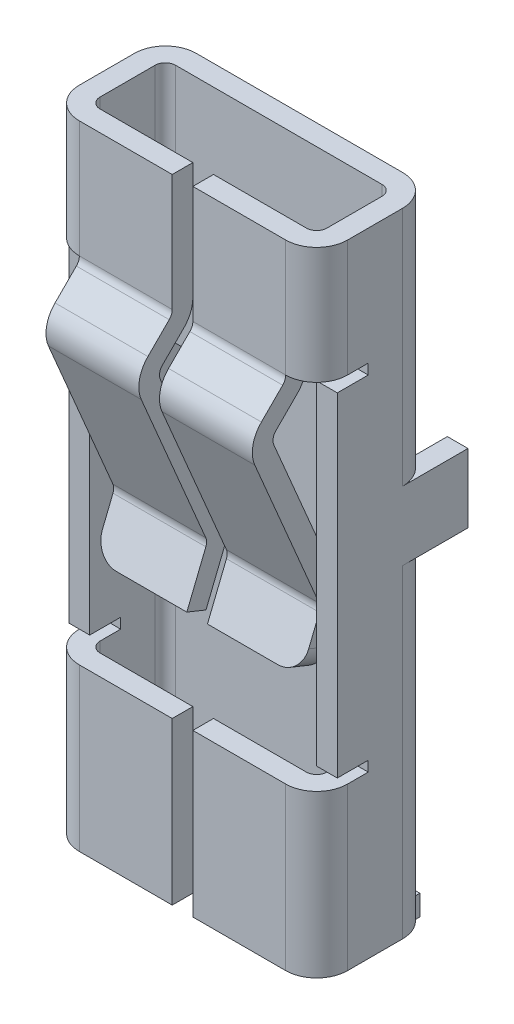
from build123d import *

# Parameters (mm, degrees)
BOSS_EXTRUDE1_DEPTH   = 1.35
BOSS_EXTRUDE1_START   = -0.15
BOSS_EXTRUDE1_2_DEPTH = 0.15
SKETCH2_W             = 0.3000000000000001
SKETCH2_H             = 9.200000000000003
BOSS_EXTRUDE2_DEPTH   = 3.1499999999999995
BOSS_EXTRUDE3_DEPTH   = 0.29999999999999993
BOSS_EXTRUDE4_DEPTH   = 0.30000000000000016
CUT_EXTRUDE1_DEPTH    = 0.15000000000000127
BOSS_EXTRUDE5_DEPTH   = 0.15000000000000127
BOSS_EXTRUDE6_DEPTH   = 1.3500000000000003
CUT_EXTRUDE2_DEPTH    = 0.3000000000000021
CUT_EXTRUDE3_DEPTH    = 0.29999999999999927
CUT_EXTRUDE4_DEPTH    = 0.15000000000000385
CUT_EXTRUDE5_DEPTH    = 0.1500000000000002
BOSS_EXTRUDE7_DEPTH   = 0.32500023179600646
SKETCH13_W            = 2.4
SKETCH13_H            = 0.30000000000000016
BOSS_EXTRUDE8_DEPTH   = 0.7500000000000016
BOSS_EXTRUDE9_DEPTH   = 0.3000000000000004
SKETCH15_W            = 0.30000000000000016
SKETCH15_H            = 0.6000000000000005
BOSS_EXTRUDE10_DEPTH  = 0.3000000000000004
BOSS_EXTRUDE11_DEPTH  = 1
SKETCH17_W            = 0.30000000000000004
SKETCH17_H            = 2.350000000000001
BOSS_EXTRUDE12_DEPTH  = 0.7499999999999998
SKETCH18_W            = 0.30000000000000004
SKETCH18_H            = 2.350000000000001
BOSS_EXTRUDE13_DEPTH  = 1.5000000000000007
BOSS_EXTRUDE14_DEPTH  = 0.4499999999999999
BOSS_EXTRUDE15_DEPTH  = 1.0499999999999998
SKETCH21_W            = 1.5
SKETCH21_H            = 0.2999999999999998
BOSS_EXTRUDE16_DEPTH  = 1
BOSS_EXTRUDE17_DEPTH  = 0.7499999999999999
SKETCH23_W            = 0.30000000000000004
SKETCH23_H            = 2.350000000000001
BOSS_EXTRUDE18_DEPTH  = 1.5000000000000004
SKETCH24_W            = 0.30000000000000004
SKETCH24_H            = 4.8500000000000005
BOSS_EXTRUDE19_DEPTH  = 0.4499999999999999
DRAFT1_START          = -1.5
DRAFT1_DEPTH          = 1.35
DRAFT2_START          = -1.5
DRAFT2_DEPTH          = 1.35
DRAFT3_ANGLE          = 45.00000000000445
DRAFT4_ANGLE          = 44.99999999999104
FILLET1_R             = 0.15000000000000022
FILLET2_R             = 0.3250000000000042
FILLET3_R             = 0.45
FILLET4_DEPTH         = 0.3
FILLET4_START         = 2.200609665
FILLET4_2_DEPTH       = 0.3
CUT_EXTRUDE6_DEPTH    = 10
CUT_EXTRUDE7_DEPTH    = 0.5
BOSS_EXTRUDE20_DEPTH  = 1


with BuildPart() as part:
    # Boss-Extrude1: read off the stored shape, not the designer's step
    # Boss-Extrude1 outline → Boss-Extrude1 (new body)
    with BuildSketch(Plane(origin=(-1.4999999999999991, 0, 0), x_dir=(0, 0, -1), z_dir=(1, 0, 0))):
        Polygon((-3.114213562, 4.812132034), (-1.7, 4.812132034), (-1.7, 2.987867966), (-2.509359079, 2.987867966), (-1.188010503, -0.125034203), (-1.365948548, -0.565446319), (-1.087793392, -0.677828297), (-0.863305207, -0.122200542), (-2.130703998, 2.863603897), (-1.4, 2.863603897), (-1.4, 4.936396103), (-2.989949494, 4.936396103), align=None)
    extrude(amount=BOSS_EXTRUDE1_DEPTH)

    # Boss-Extrude1 2 outline → Boss-Extrude1 2 (add)
    with BuildSketch(Plane(origin=(-1.4999999999999991, 0, 0), x_dir=(0, 0, -1), z_dir=(1, 0, 0)).offset(BOSS_EXTRUDE1_START)):
        Polygon((-3.114213562, 4.812132034), (-1.7, 4.812132034), (-1.7, 3.05), (-0.95, 3.05), (-0.95, -4.45), (0, -4.45), (0, 4.75), (-1.4, 4.75), (-1.4, 4.936396103), (-2.989949494, 4.936396103), align=None)
    extrude(amount=BOSS_EXTRUDE1_2_DEPTH)

    # Sketch2 → Boss-Extrude2 (add)
    with BuildSketch(Plane(origin=(-1.4999999999999991, 0, 0), x_dir=(0, 0, -1), z_dir=(1, 0, 0))):
        with Locations((-0.15000000000000005, 0.1499999999999999)):
            Rectangle(SKETCH2_W, SKETCH2_H)
    extrude(amount=BOSS_EXTRUDE2_DEPTH)

    # Sketch3 → Boss-Extrude3 (add)
    with BuildSketch(Plane(origin=(1.6500000000000004, 0, 0), x_dir=(0, 0, -1), z_dir=(1, 0, 0))):
        Polygon((-0.9500000000000003, -4.450000000000001), (-0.9500000000000003, 3.0500000000000007), (-1.7000000000000002, 3.0500000000000007), (-1.7000000000000002, 4.812132034356001), (-3.1142135623726666, 4.812132034356001), (-2.989949493660945, 4.936396103067781), (-1.4000000000000001, 4.936396103067781), (-1.4000000000000035, 4.750000000000001), (0, 4.750000000000001), (0, -4.450000000000001), align=None)
    extrude(amount=BOSS_EXTRUDE3_DEPTH)

    # Sketch4 → Boss-Extrude4 (add)
    with BuildSketch(Plane.ZY.offset(1.6500000000000001)):
        Polygon((0.9500000000000002, -4.450000000000001), (0, -4.450000000000001), (0, 4.749999999999999), (1.4000000000000037, 4.750000000000001), (1.4000000000000001, 4.936396103067801), (2.9899494936609243, 4.936396103067802), (3.1142135623726666, 4.812132034356001), (1.7000000000000002, 4.812132034356001), (1.7000000000000002, 3.0500000000000007), (0.9500000000000003, 3.0500000000000007), align=None)
    extrude(amount=BOSS_EXTRUDE4_DEPTH)

    # Sketch5 → Cut-Extrude1 (cut)
    with BuildSketch(Plane(origin=(-1.4999999999999991, 0, 0), x_dir=(0, 0, -1), z_dir=(1, 0, 0))):
        Polygon((-0.9500000000000003, 3.0500000000000007), (-0.9500000000000002, -4.450000000000001), (-0.30000000000000004, -4.450000000000001), (-0.30000000000000016, 4.750000000000001), (-1.4000000000000037, 4.750000000000001), (-1.4000000000000001, 3.0500000000000007), align=None)
    extrude(amount=-CUT_EXTRUDE1_DEPTH, mode=Mode.SUBTRACT)

    # Sketch6 → Boss-Extrude5 (add)
    with BuildSketch(Plane.ZY.offset(-1.6500000000000004)):
        Polygon((1.7000000000000002, 4.812132034356001), (1.7000000000000002, 3.0500000000000007), (1.4000000000000197, 3.0500000000000007), (1.4000000000000001, 4.936396103067882), (2.9899494936608453, 4.936396103067881), (3.1142135623726666, 4.812132034356001), align=None)
    extrude(amount=BOSS_EXTRUDE5_DEPTH)

    # Sketch7 → Boss-Extrude6 (add)
    with BuildSketch(Plane.ZY.offset(-1.4999999999999991)):
        with BuildLine():
            Line((1.7, 2.9878679656439875), (2.5093590788271998, 2.9878679656439675))
            Line((2.5093590788271998, 2.9878679656439675), (2.1495825231129353, 2.1402875156965857))
            add(Edge.make_bspline(
                [(1.2122874229840004, -0.06784136341720032), (1.52471912302698, 0.6682015962873946), (1.8371508230699576, 1.4042445559919898), (2.1495825231129353, 2.1402875156965857)],
                knots=[0, 0, 0, 0, 1, 1, 1, 1], degree=3))
            Line((1.2122874229840004, -0.06784136341720032), (1.188010503084729, -0.12503420259681308))
            Line((1.188010503084729, -0.12503420259681308), (1.2112855728167975, -0.18264202170300106))
            add(Edge.make_bspline(
                [(1.4876957778174003, -0.8667812862502003), (1.3955590428172002, -0.638734864734467), (1.3034223078170002, -0.4106884432187335), (1.2112855728167975, -0.18264202170300106)],
                knots=[0, 0, 0, 0, 1, 1, 1, 1], degree=3))
            add(Edge.make_bspline(
                [(1.2095406214473998, -0.9791632642749003), (1.3022590069040665, -0.9417026049333337), (1.3949773923607334, -0.9042419455917671), (1.4876957778174003, -0.8667812862502003)],
                knots=[0, 0, 0, 0, 1, 1, 1, 1], degree=3))
            add(Edge.make_bspline(
                [(0.9331304164468003, -0.2950239997277002), (1.0252671514470002, -0.5230704212434336), (1.1174038864472, -0.7511168427591669), (1.2095406214473998, -0.9791632642749003)],
                knots=[0, 0, 0, 0, 1, 1, 1, 1], degree=3))
            Line((0.9331304164468003, -0.2950239997277002), (0.8633052072505193, -0.12220054240891351))
            Line((0.8633052072505193, -0.12220054240891351), (0.9361359669482366, 0.04937797512958447))
            add(Edge.make_bspline(
                [(1.8734310670777075, 2.2575068542431853), (1.5609993670345503, 1.5214638945386514), (1.2485676669913934, 0.7854209348341182), (0.9361359669482366, 0.04937797512958447)],
                knots=[0, 0, 0, 0, 1, 1, 1, 1], degree=3))
            Line((1.8734310670777075, 2.2575068542431853), (2.1307039978783813, 2.8636038969319726))
            Line((2.1307039978783813, 2.8636038969319726), (1.400000000000637, 2.863603896931973))
            Line((1.400000000000637, 2.863603896931973), (1.400000000000637, 4.936396103067612))
            Line((1.400000000000637, 4.936396103067612), (2.9899494936614825, 4.936396103067612))
            Line((2.9899494936614825, 4.936396103067612), (3.1142135623733327, 4.812132034355761))
            Line((3.1142135623733327, 4.812132034355761), (1.6999999999999997, 4.812132034355761))
            Line((1.6999999999999997, 4.812132034355761), (1.7, 2.9878679656439875))
        make_face()
    extrude(amount=BOSS_EXTRUDE6_DEPTH)

    # Sketch8 → Cut-Extrude2 (cut)
    with BuildSketch(Plane(origin=(1.9500000000000004, 0, 0), x_dir=(0, 0, -1), z_dir=(1, 0, 0))):
        Polygon((-1.7000000000000002, 4.750000000000001), (-1.4000000000000035, 4.750000000000001), (-1.4000000000000001, 4.936396103067781), (-2.989949493660945, 4.936396103067781), (-3.1142135623726666, 4.812132034356001), (-1.7000000000000002, 4.812132034356001), align=None)
    extrude(amount=-CUT_EXTRUDE2_DEPTH, mode=Mode.SUBTRACT)

    # Sketch9 → Cut-Extrude3 (cut)
    with BuildSketch(Plane.ZY.offset(1.9500000000000004)):
        Polygon((1.7000000000000035, 4.750000000000001), (1.7000000000000002, 4.812132034356001), (3.1142135623726666, 4.812132034356001), (2.9899494936609243, 4.936396103067802), (1.4000000000000001, 4.936396103067801), (1.4000000000000037, 4.750000000000001), align=None)
    extrude(amount=-CUT_EXTRUDE3_DEPTH, mode=Mode.SUBTRACT)

    # Sketch10 → Cut-Extrude4 (cut)
    with BuildSketch(Plane(origin=(1.6499999999999984, 0, 0), x_dir=(-7.23e-15, 0, -1), z_dir=(1, 0, -7.23e-15))):
        Polygon((-1.7000000000000153, 4.750000000000001), (-1.4000000000000155, 4.750000000000001), (-1.4000000000000121, 4.936396103067781), (-2.989949493660957, 4.936396103067781), (-3.1142135623726785, 4.812132034356001), (-1.700000000000012, 4.812132034356001), align=None)
    extrude(amount=-CUT_EXTRUDE4_DEPTH, mode=Mode.SUBTRACT)

    # Sketch11 → Cut-Extrude5 (cut)
    with BuildSketch(Plane.ZY.offset(1.650000000000001)):
        Polygon((1.700000000000013, 4.750000000000018), (1.7000000000000097, 4.8121320343560186), (3.114213562372676, 4.8121320343560186), (2.9899494936609337, 4.936396103067819), (1.4000000000000097, 4.9363961030678185), (1.4000000000000132, 4.750000000000018), align=None)
    extrude(amount=-CUT_EXTRUDE5_DEPTH, mode=Mode.SUBTRACT)

    # Sketch12 → Boss-Extrude7 (add)
    with BuildSketch(Plane(origin=(0, -0.9605309765461568, 0.3880797052513418), x_dir=(1, 0, 0), z_dir=(0, -0.9271838545669052, 0.37460659341562025))):
        Polygon((-0.15000000000000005, 1.0546655208211408), (-0.15000000000000005, 0.7546655208212015), (-1.5, 0.7546655208212013), (-1.5000000000000002, 1.0546655208211408), align=None)
    extrude(amount=BOSS_EXTRUDE7_DEPTH)

    # Sketch13 → Boss-Extrude8 (add)
    with BuildSketch(Plane(origin=(0, 4.750000000000001, 0), x_dir=(-1, 0, 0), z_dir=(0, 1, 0))):
        with Locations((0, 0.15000000000000008)):
            Rectangle(SKETCH13_W, SKETCH13_H)
    extrude(amount=BOSS_EXTRUDE8_DEPTH)

    # Sketch14 → Boss-Extrude9 (add)
    with BuildSketch(Plane.ZY.offset(1.2)):
        Polygon((0, 5.500000000000001), (0.30000000000000016, 5.500000000000001), (0.30000000000000016, 4.900000000000001), (0, 4.9), align=None)
    extrude(amount=BOSS_EXTRUDE9_DEPTH)

    # Sketch15 → Boss-Extrude10 (add)
    with BuildSketch(Plane(origin=(1.2, 0, 0), x_dir=(0, 0, -1), z_dir=(1, 0, 0))):
        with Locations((-0.15000000000000008, 5.200000000000001)):
            Rectangle(SKETCH15_W, SKETCH15_H)
    extrude(amount=BOSS_EXTRUDE10_DEPTH)

    # Sketch16 → Boss-Extrude11 (add)
    with BuildSketch(Plane(origin=(0, 0, 0), x_dir=(-1, 0, 0), z_dir=(0, 0, -1))):
        Polygon((1.4999999999999998, 5.200000000000001), (-1.4999999999999996, 5.200000000000001), (-1.5000000000000002, 5.500000000000001), (1.5000000000000002, 5.500000000000001), align=None)
    extrude(amount=BOSS_EXTRUDE11_DEPTH)

    # Sketch17 → Boss-Extrude12 (add)
    with BuildSketch(Plane.XY.offset(0.9500000000000003)):
        with Locations((1.8000000000000003, -3.2750000000000004)):
            Rectangle(SKETCH17_W, SKETCH17_H)
    extrude(amount=BOSS_EXTRUDE12_DEPTH)

    # Sketch18 → Boss-Extrude13 (add)
    with BuildSketch(Plane.ZY.offset(-1.6500000000000004)):
        with Locations((1.5500000000000003, -3.2750000000000004)):
            Rectangle(SKETCH18_W, SKETCH18_H)
    extrude(amount=BOSS_EXTRUDE13_DEPTH)

    # Sketch19 → Boss-Extrude14 (add)
    with BuildSketch(Plane.XY.offset(0.9500000000000003)):
        Polygon((1.6500000000000004, -1.9500000000000004), (1.6500000000000004, 2.9), (1.9500000000000004, 2.9000000000000004), (1.9500000000000004, -1.9500000000000002), align=None)
    extrude(amount=BOSS_EXTRUDE14_DEPTH)

    # Sketch20 → Boss-Extrude15 (add)
    with BuildSketch(Plane.XZ.offset(4.450000000000001)):
        Polygon((-0.7500000000000001, 0), (-0.7500000000000001, 0.30000000000000016), (0.7500000000000001, 0.30000000000000004), (0.7500000000000001, 0), align=None)
    extrude(amount=BOSS_EXTRUDE15_DEPTH)

    # Sketch21 → Boss-Extrude16 (add)
    with BuildSketch(Plane(origin=(0, 0, 0), x_dir=(-1, 0, 0), z_dir=(0, 0, -1))):
        with Locations((0, -5.350000000000001)):
            Rectangle(SKETCH21_W, SKETCH21_H)
    extrude(amount=BOSS_EXTRUDE16_DEPTH)

    # Sketch22 → Boss-Extrude17 (add)
    with BuildSketch(Plane.XY.offset(0.9500000000000003)):
        Polygon((-1.6500000000000001, -4.450000000000001), (-1.9500000000000004, -4.450000000000001), (-1.9500000000000004, -2.1), (-1.6500000000000004, -2.1), align=None)
    extrude(amount=BOSS_EXTRUDE17_DEPTH)

    # Sketch23 → Boss-Extrude18 (add)
    with BuildSketch(Plane(origin=(-1.6500000000000004, 0, 0), x_dir=(0, 0, -1), z_dir=(1, 0, 0))):
        with Locations((-1.5500000000000003, -3.2750000000000004)):
            Rectangle(SKETCH23_W, SKETCH23_H)
    extrude(amount=BOSS_EXTRUDE18_DEPTH)

    # Sketch24 → Boss-Extrude19 (add)
    with BuildSketch(Plane.XY.offset(0.9500000000000003)):
        with Locations((-1.8000000000000003, 0.475)):
            Rectangle(SKETCH24_W, SKETCH24_H)
    extrude(amount=BOSS_EXTRUDE19_DEPTH)

    # Draft1: read off the stored shape, not the designer's step
    # Draft1 outline → Draft1 (add)
    with BuildSketch(Plane.YZ.offset(DRAFT1_START)):
        Polygon((4.936396103, 2.989949494), (4.936396103, 1.4), (5.73137085, 2.194974747), align=None)
        Polygon((2.863603897, 2.130703998), (2.350640109, 1.912963788), (2.863603897, 1.4), align=None)
    extrude(amount=DRAFT1_DEPTH)

    # Draft2: read off the stored shape, not the designer's step
    # Draft2 outline → Draft2 (cut)
    with BuildSketch(Plane.YZ.offset(DRAFT2_START)):
        Polygon((4.812132034, 1.7), (5.519238816, 2.407106781), (4.812132034, 3.114213562), align=None)
        Polygon((2.419687279, 2.268180686), (2.987867966, 1.7), (2.987867966, 2.509359079), align=None)
    extrude(amount=DRAFT2_DEPTH, mode=Mode.SUBTRACT)

    # Draft3
    draft3_faces = [part.faces().sort_by_distance(p)[0] for p in [
        (0.824999999999999, 2.863603896931973, 1.7653519989395092),
        (0.8250000000000098, 4.936396103067781, 2.194974746830841),
    ]]
    draft(draft3_faces, Plane(origin=(1.9500000000000004, 4.936396103067781, 1.4000000000000001), x_dir=(0, -1, 1.745e-14), z_dir=(0, -1.745e-14, -1)), DRAFT3_ANGLE)

    # Draft4
    draft4_faces = [part.faces().sort_by_distance(p)[0] for p in [
        (0.8249999999999654, 4.812132034356001, 2.4071067811865423),
        (0.824999999999999, 2.9878679656439773, 2.1046795394136),
    ]]
    draft(draft4_faces, Plane(origin=(1.9500000000000004, 3.0500000000000007, 1.7000000000000002), x_dir=(1, 0, 0), z_dir=(0, 0, 1)), DRAFT4_ANGLE)

    # Fillet1
    fillet1_edges = [part.edges().sort_by_distance(p)[0] for p in [
        (-0.82500000000003, 4.812132034, 1.7),
        (-0.825, 2.350640109, 1.912963788),
        (-0.8249999999999991, 2.987867966, 1.7),
        (-0.8249999999999991, -0.125034203, 1.188010503),
        (1.6500000000000004, 0.15000000000000036, 0.3000000000000001),
        (-1.6500000000000004, 3.900000000000001, 1.400000000000002),
        (-1.6500000000000004, 0.15000000000000036, 0.3000000000000001),
        (1.6500000000000004, 3.900000000000001, 1.4000000000000108),
        (0.824999999999999, 2.9878679656439875, 1.7000000000000002),
        (0.824999999999999, 2.350640108760132, 1.9129637881718162),
        (0.824999999999999, -0.12503420259681308, 1.188010503084729),
        (0.8250000000000027, 4.812132034356001, 1.7000000000000002),
        (-2.2e-16, 5.200000000000001, 0),
        (1.6500000000000004, -3.2750000000000004, 1.4000000000000001),
        (1.1e-16, -5.200000000000001, 0),
        (-1.6500000000000004, -3.2750000000000004, 1.4000000000000001),
    ]]
    fillet(fillet1_edges, radius=FILLET1_R)

    # Fillet2
    fillet2_edges = [part.edges().sort_by_distance(p)[0] for p in [
        (-1.5, -0.922972275262529, 1.3486181996324813),
        (1.4999999999999991, -0.9229722752625503, 1.3486181996324),
    ]]
    fillet(fillet2_edges, radius=FILLET2_R)

    # Fillet3
    fillet3_edges = [part.edges().sort_by_distance(p)[0] for p in [
        (-0.8249999999999991, -0.122200542, 0.863305207),
        (-0.8249999999999991, 2.863603897, 1.4),
        (-0.825, 2.419687279, 2.268180686),
        (1.9500000000000002, 0.14999999999999947, 0),
        (-1.9500000000000002, 3.900000000000001, 1.7000000000000002),
        (-1.9500000000000002, 0.14999999999999858, 0),
        (0.824999999999999, 2.863603896931973, 1.4000000000000372),
        (0.824999999999999, -0.12220054240891351, 0.8633052072505193),
        (0.824999999999999, 2.4196872792485182, 2.268180686395647),
        (1.9500000000000002, 3.900000000000001, 1.7000000000000002),
        (0.8250000000000017, 4.936396103067781, 1.4000000000000001),
        (-0.8250000000000298, 4.936396103, 1.4),
        (0, 5.500000000000001, 0.30000000000000016),
        (1.9500000000000004, -3.2750000000000004, 1.7000000000000002),
        (0, -5.500000000000001, 0.3000000000000001),
        (-1.9500000000000004, -3.2750000000000004, 1.7000000000000002),
    ]]
    fillet(fillet3_edges, radius=FILLET3_R)

    # Fillet4: read off the stored shape, not the designer's step
    # Fillet4 outline → Fillet4 (add)
    with BuildSketch(Plane.XY):
        with BuildLine():
            Line((-0.75, -4.45), (-1.375, -4.45))
            ThreePointArc((-1.375, -4.45), (-0.933058262, -4.633058262), (-0.75, -5.075))
            Line((-0.75, -5.075), (-0.75, -4.45))
        make_face()
        with BuildLine():
            ThreePointArc((0.75, -5.075), (0.933058262, -4.633058262), (1.375, -4.45))
            Line((1.375, -4.45), (0.75, -4.45))
            Line((0.75, -4.45), (0.75, -5.075))
        make_face()
    extrude(amount=FILLET4_DEPTH)

    # Fillet4 2 outline → Fillet4 2 (cut)
    with BuildSketch(Plane(origin=(0, 0, 0), x_dir=(1, 0, 0), z_dir=(0, 0.707106781186714, -0.707106781186381)).offset(FILLET4_START)):
        with BuildLine():
            ThreePointArc((-0.875, -5.604772721), (-1.316941738, -5.421714459), (-1.5, -4.979772721))
            Line((-1.5, -4.979772721), (-1.5, -5.604772721))
            Line((-1.5, -5.604772721), (-0.875, -5.604772721))
        make_face()
        with BuildLine():
            ThreePointArc((1.5, -4.979772721), (1.316941738, -5.421714459), (0.875, -5.604772721))
            Line((0.875, -5.604772721), (1.5, -5.604772721))
            Line((1.5, -5.604772721), (1.5, -4.979772721))
        make_face()
    extrude(amount=FILLET4_2_DEPTH, mode=Mode.SUBTRACT)

    # Sketch25 → Cut-Extrude6 (cut)
    with BuildSketch(Plane(origin=(0, 4.750000000000001, 0), x_dir=(1, 0, 0), z_dir=(0, 1, 0))):
        Polygon((-2.150597413752126, 1.4408106156054146), (2.3120536760458297, 1.4408106156054146), (2.3120536760458292, -3.1035844529903045), (-2.150597413752126, -3.1035844529903045), align=None)
    extrude(amount=CUT_EXTRUDE6_DEPTH, mode=Mode.SUBTRACT)

    # Sketch26 → Cut-Extrude7 (cut)
    with BuildSketch(Plane(origin=(0, 0, 0), x_dir=(-1, 0, 0), z_dir=(0, 0, -1))):
        Polygon((-1.9500000000000004, 1.2500000000000002), (-0.9500000000000003, 1.2500000000000002), (-0.9500000000000002, 0.2500000000000002), (-1.9500000000000002, 0.2500000000000002), align=None)
        Polygon((1.9500000000000004, 1.2500000000000002), (0.9500000000000003, 1.2500000000000002), (0.9500000000000004, 0.25), (1.9500000000000004, 0.2500000000000002), align=None)
    extrude(amount=-CUT_EXTRUDE7_DEPTH, mode=Mode.SUBTRACT)

    # Sketch27 → Boss-Extrude20 (add)
    with BuildSketch(Plane(origin=(0, 0, 0.5), x_dir=(-1, 0, 0), z_dir=(0, 0, -1))):
        Polygon((1.6500000000000004, 0.25000000000000017), (1.9500000000000004, 0.2500000000000002), (1.9500000000000004, 1.2500000000000002), (1.6500000000000004, 1.2500000000000002), align=None)
        Polygon((-1.6500000000000004, 1.2500000000000002), (-1.9500000000000004, 1.2500000000000002), (-1.9500000000000002, 0.2500000000000002), (-1.6500000000000004, 0.2500000000000002), align=None)
    extrude(amount=BOSS_EXTRUDE20_DEPTH)


solid = part.part
